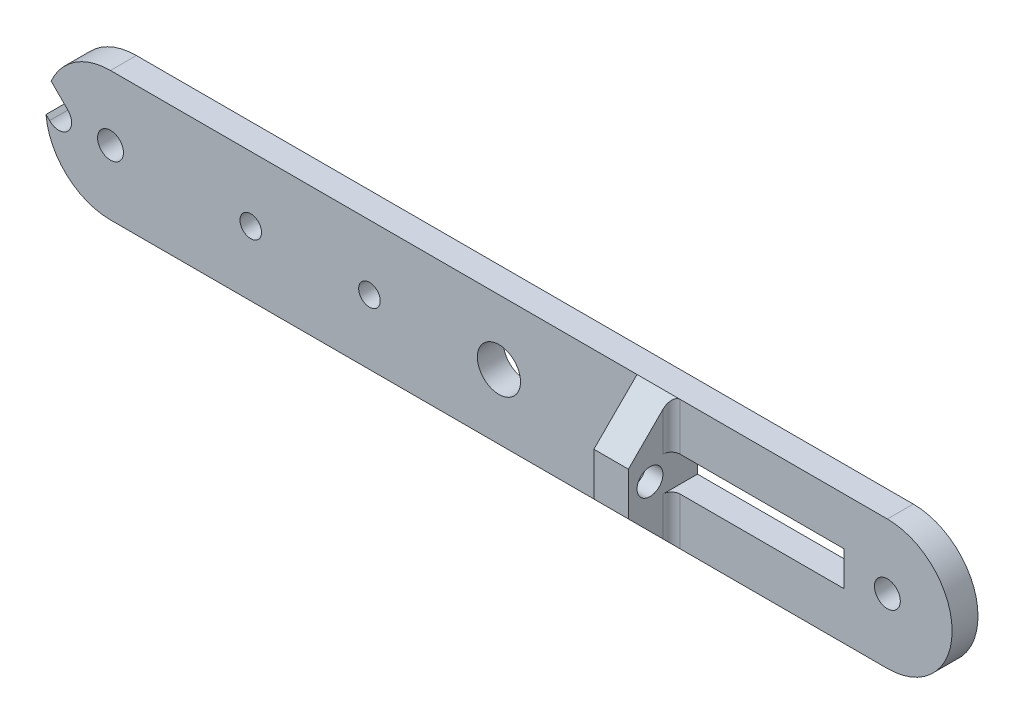
from build123d import *

# Parameters (mm, degrees)
ESQUISSE1_R             = 3
ESQUISSE1_R_2           = 5
ESQUISSE1_R_3           = 2.5
ESQUISSE1_W             = 40
ESQUISSE1_H             = 8
BOSS_EXTRU_1_DEPTH      = 6
ESQUISSE2_R             = 3
BOSS_EXTRU_2_DEPTH      = 8
CONG_2_R                = 2
ENL_V_MAT_EXTRU_1_DEPTH = 4
ENL_V_START             = -10
ENL_V_MAT_EXTRU_4_DEPTH = 10


with BuildPart() as part:
    # Esquisse1 → Boss.-Extru.1 (new body)
    with BuildSketch(Plane.XY):
        with BuildLine():
            Line((90, -15), (-90, -15))
            ThreePointArc((-90, -15), (-105, 0), (-90, 15))
            Line((-90, 15), (90, 15))
            ThreePointArc((90, 15), (105, 0), (90, -15))
        make_face()
        with Locations((90, 0)):
            Circle(ESQUISSE1_R, mode=Mode.SUBTRACT)
        with Locations(Location((-90, 0, 0), (0, 0, 180))):
            Circle(ESQUISSE1_R, mode=Mode.SUBTRACT)
        Circle(ESQUISSE1_R_2, mode=Mode.SUBTRACT)
        with Locations((-57.5, 0)):
            Circle(ESQUISSE1_R_3, mode=Mode.SUBTRACT)
        with Locations((-30, 0)):
            Circle(ESQUISSE1_R_3, mode=Mode.SUBTRACT)
        with Locations((60, 0)):
            Rectangle(ESQUISSE1_W, ESQUISSE1_H, mode=Mode.SUBTRACT)
    extrude(amount=BOSS_EXTRU_1_DEPTH)

    # Esquisse2 → Boss.-Extru.2 (add)
    with BuildSketch(Plane(origin=(40, 0, 0), x_dir=(0, 0, -1), z_dir=(1, 0, 0))):
        Polygon((-16, 5), (-16, -5), (-6, -15), (-6, -5), (-6, 5), (-6, 15), align=None)
        with Locations((-11, 0)):
            Circle(ESQUISSE2_R, mode=Mode.SUBTRACT)
    extrude(amount=-BOSS_EXTRU_2_DEPTH)

    # Congé2
    cong_2_edges = [part.edges().sort_by_distance(p)[0] for p in [
        (40, 9.5, 6),
        (40, -9.5, 6),
    ]]
    fillet(cong_2_edges, radius=CONG_2_R - 0.0001)  # a hair under: the kernel refuses the full size

    # Esquisse3 → Enlèv. mat.-Extru.1 (cut)
    with BuildSketch(Plane.ZY.offset(-32)):
        Polygon((11, 4), (14.464101615, 2), (14.464101615, -2), (11, -4), (7.535898385, -2), (7.535898385, 2), align=None)
    extrude(amount=-ENL_V_MAT_EXTRU_1_DEPTH, mode=Mode.SUBTRACT)

    # Esquisse4 → Enlèv. mat.-Extru.4 (cut)
    with BuildSketch(Plane.XY.offset(6).offset(ENL_V_START)):
        with BuildLine():
            ThreePointArc((-105, 0), (-104.771638598, -1.148050297), (-104.121320344, -2.121320344))
            Line((-104.121320344, -2.121320344), (-99.878679656, 2.121320344))
            ThreePointArc((-99.878679656, 2.121320344), (-103.148050297, 2.771638598), (-105, 0))
        make_face()
        with BuildLine():
            Line((-99.878679656, 2.121320344), (-104.121320344, -2.121320344))
            ThreePointArc((-104.121320344, -2.121320344), (-100.851949703, -2.771638598), (-99, 0))
            ThreePointArc((-99, 0), (-99.228361402, 1.148050297), (-99.878679656, 2.121320344))
        make_face()
        with BuildLine():
            ThreePointArc((-105, 0), (-103.148050297, 2.771638598), (-99.878679656, 2.121320344))
            Line((-99.878679656, 2.121320344), (-103.750652313, 5.993293))
            ThreePointArc((-103.750652313, 5.993293), (-104.68434174, 3.061063158), (-105, 0))
        make_face()
        with BuildLine():
            Line((-104.94364809, -1.298992597), (-104.121320344, -2.121320344))
            ThreePointArc((-104.121320344, -2.121320344), (-104.771638598, -1.148050297), (-105, 0))
            ThreePointArc((-105, 0), (-104.985905401, -0.650107165), (-104.94364809, -1.298992597))
        make_face()
        with BuildLine():
            ThreePointArc((-105, 0), (-104.771638598, -1.148050297), (-104.121320344, -2.121320344))
            Line((-104.121320344, -2.121320344), (-99.878679656, 2.121320344))
            ThreePointArc((-99.878679656, 2.121320344), (-103.148050297, 2.771638598), (-105, 0))
        make_face()
        with BuildLine():
            Line((-99.878679656, 2.121320344), (-104.121320344, -2.121320344))
            ThreePointArc((-104.121320344, -2.121320344), (-100.851949703, -2.771638598), (-99, 0))
            ThreePointArc((-99, 0), (-99.228361402, 1.148050297), (-99.878679656, 2.121320344))
        make_face()
    extrude(amount=ENL_V_MAT_EXTRU_4_DEPTH, mode=Mode.SUBTRACT)


solid = part.part
